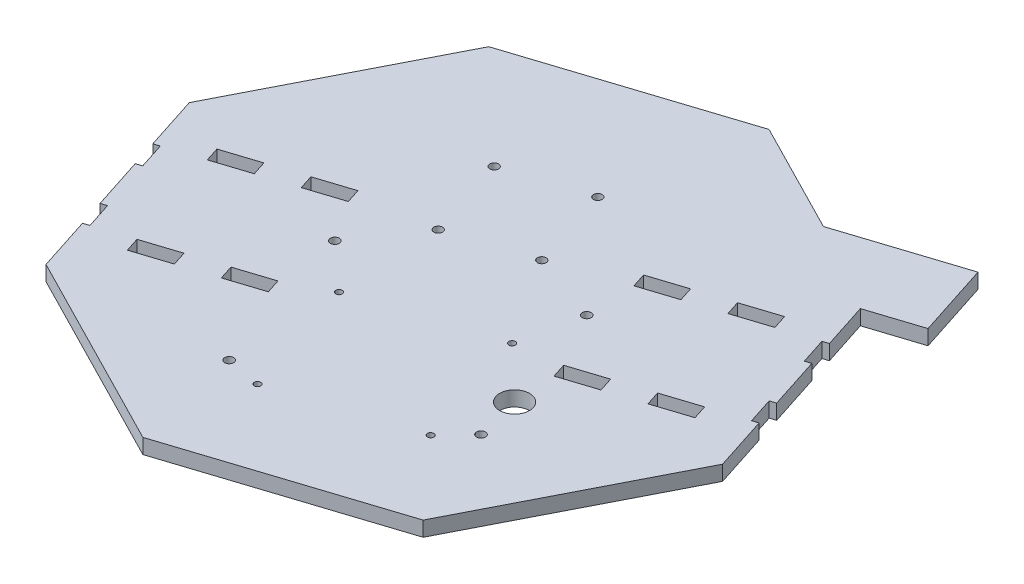
from build123d import *

# Parameters (mm, degrees)
BOSS_EXTRUDE1_DEPTH = 3.175
BOSS_EXTRUDE2_DEPTH = 6.35
CAVITY2_START       = -95.885
CAVITY2_OUTLINE_W   = 6.35
CAVITY2_OUTLINE_H   = 6.35
CAVITY2_DEPTH       = 15.875
CAVITY2_START_2     = -64.135
CAVITY2_2_OUTLINE_W = 6.35
CAVITY2_2_OUTLINE_H = 6.35
CAVITY2_2_DEPTH     = 15.875
SKETCH6_R           = 1.3716
CUT_EXTRUDE1_DEPTH  = 175.52022504
SKETCH7_R           = 6.35
CUT_EXTRUDE2_DEPTH  = 175.52022504
SKETCH9_R           = 1.905
CUT_EXTRUDE3_DEPTH  = 175.52022504
SKETCH10_R          = 1.85
CUT_EXTRUDE4_DEPTH  = 175.52022504
CAVITY3_START       = 48.26
CAVITY3_OUTLINE_W   = 6.35
CAVITY3_OUTLINE_H   = 6.35
CAVITY3_DEPTH       = 15.875
CAVITY3_START_2     = 80.01
CAVITY3_2_OUTLINE_W = 6.35
CAVITY3_2_OUTLINE_H = 6.35
CAVITY3_2_DEPTH     = 15.875
CAVITY3_START_3     = -95.885
CAVITY3_3_OUTLINE_W = 6.35
CAVITY3_3_OUTLINE_H = 6.35
CAVITY3_3_DEPTH     = 15.875
CAVITY3_START_4     = -64.135
CAVITY3_4_OUTLINE_W = 6.35
CAVITY3_4_OUTLINE_H = 6.35
CAVITY3_4_DEPTH     = 15.875
CAVITY3_START_5     = -114.3
CAVITY3_5_OUTLINE_W = 6.35
CAVITY3_5_OUTLINE_H = 11.6205
CAVITY3_5_DEPTH     = 2.54
CAVITY3_START_6     = 111.76
CAVITY3_6_OUTLINE_W = 6.35
CAVITY3_6_OUTLINE_H = 11.6205
CAVITY3_6_DEPTH     = 2.54


# Read off the part's stored shape, not the designer's step: Cavity2, Cavity3
with BuildPart() as part:
    # Sketch1 → Boss-Extrude1 (new, symmetric)
    with BuildSketch(Plane(origin=(0, 0, 0), x_dir=(1, 0, 0), z_dir=(0, 1, 0))):
        Polygon((9.874658932, 123.322719821), (-80.219893167, 94.184769753), (-123.322719821, 9.874658932), (-94.184769753, -80.219893167), (-9.874658932, -123.322719821), (80.219893167, -94.184769753), (123.322719821, -9.874658932), (94.184769753, 80.219893167), align=None)
    extrude(amount=BOSS_EXTRUDE1_DEPTH, both=True)

    # Sketch3 → Boss-Extrude2 (add)
    with BuildSketch(Plane(origin=(0, 3.175, 0), x_dir=(1, 0, 0), z_dir=(0, 1, 0))):
        Polygon((95.310120051, 76.74030964), (117.060869008, 83.774833064), (106.89989073, 115.192581558), (57.210976805, 99.122430154), (94.184769753, 80.219893167), align=None)
    extrude(amount=-BOSS_EXTRUDE2_DEPTH)

    # Cavity2 outline → Cavity2 (cut)
    with BuildSketch(Plane(origin=(0, 0, 0), x_dir=(0, 1, 0), z_dir=(0.9514763323416664, 0, -0.3077219345344931)).offset(CAVITY2_START)):
        with Locations((0, 26.416)):
            Rectangle(CAVITY2_OUTLINE_W, CAVITY2_OUTLINE_H)
    extrude(amount=CAVITY2_DEPTH, mode=Mode.SUBTRACT)

    # Cavity2 2 outline → Cavity2 2 (cut)
    with BuildSketch(Plane(origin=(0, 0, 0), x_dir=(0, 1, 0), z_dir=(0.9514763323416664, 0, -0.3077219345344931)).offset(CAVITY2_START_2)):
        with Locations((0, 26.416)):
            Rectangle(CAVITY2_2_OUTLINE_W, CAVITY2_2_OUTLINE_H)
    extrude(amount=CAVITY2_2_DEPTH, mode=Mode.SUBTRACT)

    # Sketch6 → Cut-Extrude1 (cut, through all)
    with BuildSketch(Plane(origin=(0, 3.175, 0), x_dir=(1, 0, 0), z_dir=(0, 1, 0))):
        with Locations(Location((-5.097490915, -79.318746248, 0), (0, 0, 270))):
            Circle(SKETCH6_R)
        with Locations(Location((50.579592916, -61.311929511, 0), (0, 0, 270))):
            Circle(SKETCH6_R)
        with Locations(Location((34.017198322, -10.100999466, 0), (0, 0, 270))):
            Circle(SKETCH6_R)
        with Locations(Location((-21.659885509, -28.107816203, 0), (0, 0, 270))):
            Circle(SKETCH6_R)
    extrude(amount=-CUT_EXTRUDE1_DEPTH, mode=Mode.SUBTRACT)

    # Sketch7 → Cut-Extrude2 (cut, through all)
    with BuildSketch(Plane(origin=(0, 3.175, 0), x_dir=(1, 0, 0), z_dir=(0, 1, 0))):
        with Locations(Location((56.160215938, -31.223340716, 0), (0, 0, 270))):
            Circle(SKETCH7_R)
    extrude(amount=-CUT_EXTRUDE2_DEPTH, mode=Mode.SUBTRACT)

    # Sketch9 → Cut-Extrude3 (cut, through all)
    with BuildSketch(Plane(origin=(0, 3.175, 0), x_dir=(1, 0, 0), z_dir=(0, 1, 0))):
        with Locations(Location((-19.963200574, -76.531714164, 0), (0, 0, 270))):
            Circle(SKETCH9_R)
        with Locations(Location((-41.457577702, -10.07109235, 0), (0, 0, 270))):
            Circle(SKETCH9_R)
        with Locations(Location((60.997920545, -50.347654754, 0), (0, 0, 270))):
            Circle(SKETCH9_R)
        with Locations(Location((39.503543417, 16.11296706, 0), (0, 0, 270))):
            Circle(SKETCH9_R)
    extrude(amount=-CUT_EXTRUDE3_DEPTH, mode=Mode.SUBTRACT)

    # Sketch10 → Cut-Extrude4 (cut, through all)
    with BuildSketch(Plane(origin=(0, 3.175, 0), x_dir=(1, 0, 0), z_dir=(0, 1, 0))):
        with Locations(Location((-1.658619289, 61.997975629, 0), (0, 0, 270))):
            Circle(SKETCH10_R)
        with Locations(Location((-34.960290921, 51.22770792, 0), (0, 0, 270))):
            Circle(SKETCH10_R)
        with Locations(Location((-23.574579343, 16.023083623, 0), (0, 0, 270))):
            Circle(SKETCH10_R)
        with Locations(Location((9.727092289, 26.793351332, 0), (0, 0, 270))):
            Circle(SKETCH10_R)
    extrude(amount=-CUT_EXTRUDE4_DEPTH, mode=Mode.SUBTRACT)

    # Cavity3 outline → Cavity3 (cut)
    with BuildSketch(Plane(origin=(0, 0, 0), x_dir=(0, 1, 0), z_dir=(0.9514763323416664, 0, -0.3077219345344931)).offset(CAVITY3_START)):
        with Locations((0, 26.416)):
            Rectangle(CAVITY3_OUTLINE_W, CAVITY3_OUTLINE_H)
        with Locations((0, -26.416)):
            Rectangle(CAVITY3_OUTLINE_W, CAVITY3_OUTLINE_H)
    extrude(amount=CAVITY3_DEPTH, mode=Mode.SUBTRACT)

    # Cavity3 2 outline → Cavity3 2 (cut)
    with BuildSketch(Plane(origin=(0, 0, 0), x_dir=(0, 1, 0), z_dir=(0.9514763323416664, 0, -0.3077219345344931)).offset(CAVITY3_START_2)):
        with Locations((0, 26.416)):
            Rectangle(CAVITY3_2_OUTLINE_W, CAVITY3_2_OUTLINE_H)
        with Locations((0, -26.416)):
            Rectangle(CAVITY3_2_OUTLINE_W, CAVITY3_2_OUTLINE_H)
    extrude(amount=CAVITY3_2_DEPTH, mode=Mode.SUBTRACT)

    # Cavity3 3 outline → Cavity3 3 (cut)
    with BuildSketch(Plane(origin=(0, 0, 0), x_dir=(0, 1, 0), z_dir=(0.9514763323416664, 0, -0.3077219345344931)).offset(CAVITY3_START_3)):
        with Locations((0, -26.416)):
            Rectangle(CAVITY3_3_OUTLINE_W, CAVITY3_3_OUTLINE_H)
    extrude(amount=CAVITY3_3_DEPTH, mode=Mode.SUBTRACT)

    # Cavity3 4 outline → Cavity3 4 (cut)
    with BuildSketch(Plane(origin=(0, 0, 0), x_dir=(0, 1, 0), z_dir=(0.9514763323416664, 0, -0.3077219345344931)).offset(CAVITY3_START_4)):
        with Locations((0, -26.416)):
            Rectangle(CAVITY3_4_OUTLINE_W, CAVITY3_4_OUTLINE_H)
    extrude(amount=CAVITY3_4_DEPTH, mode=Mode.SUBTRACT)

    # Cavity3 5 outline → Cavity3 5 (cut)
    with BuildSketch(Plane(origin=(0, 0, 0), x_dir=(0, 1, 0), z_dir=(0.9514763323416664, 0, -0.3077219345344931)).offset(CAVITY3_START_5)):
        with Locations((0, 17.43075)):
            Rectangle(CAVITY3_5_OUTLINE_W, CAVITY3_5_OUTLINE_H)
        with Locations((0, -17.43075)):
            Rectangle(CAVITY3_5_OUTLINE_W, CAVITY3_5_OUTLINE_H)
    extrude(amount=CAVITY3_5_DEPTH, mode=Mode.SUBTRACT)

    # Cavity3 6 outline → Cavity3 6 (cut)
    with BuildSketch(Plane(origin=(0, 0, 0), x_dir=(0, 1, 0), z_dir=(0.9514763323416664, 0, -0.3077219345344931)).offset(CAVITY3_START_6)):
        with Locations((0, 17.43075)):
            Rectangle(CAVITY3_6_OUTLINE_W, CAVITY3_6_OUTLINE_H)
        with Locations((0, -17.43075)):
            Rectangle(CAVITY3_6_OUTLINE_W, CAVITY3_6_OUTLINE_H)
    extrude(amount=CAVITY3_6_DEPTH, mode=Mode.SUBTRACT)


solid = part.part
